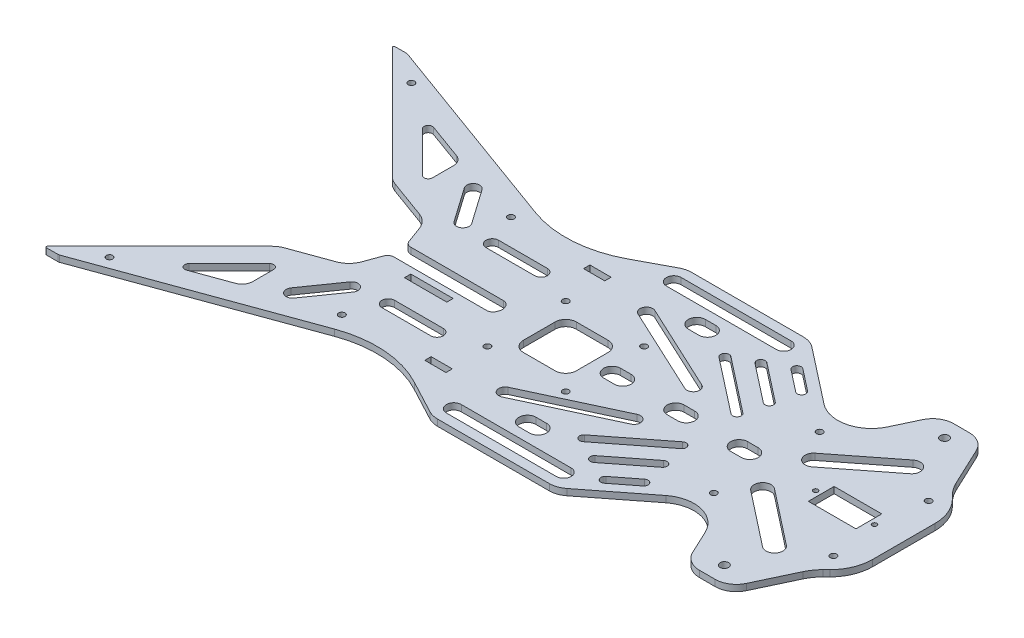
from build123d import *
from OCP.BRepFilletAPI import BRepFilletAPI_MakeFillet

# Parameters (mm, degrees)
BOSS_EXTRUDE1_DEPTH        = 3
CUT_EXTRUDE1_DEPTH         = 227.615470034
CUT_EXTRUDE2_DEPTH         = 227.615470034
CUT_EXTRUDE3_DEPTH         = 227.615470034
CUT_EXTRUDE4_DEPTH         = 227.615470034
CUT_EXTRUDE5_DEPTH         = 227.615470034
CUT_EXTRUDE6_DEPTH         = 227.615470034
CUT_EXTRUDE7_DEPTH         = 227.615470034
CUT_EXTRUDE8_DEPTH         = 227.615470034
CUT_EXTRUDE9_DEPTH         = 227.615470034
CUT_EXTRUDE10_DEPTH        = 227.615470034
CUT_EXTRUDE11_DEPTH        = 227.615470034
CUT_EXTRUDE13_DEPTH        = 227.615470034
CUT_EXTRUDE14_DEPTH        = 227.615470034
CUT_EXTRUDE15_DEPTH        = 227.615470034
CUT_EXTRUDE16_DEPTH        = 227.615470034
SKETCH18_W                 = 22.5
SKETCH18_H                 = 12.2
CUT_EXTRUDE17_DEPTH        = 227.615470034
CUT_EXTRUDE18_DEPTH        = 227.615470034
CUT_EXTRUDE19_DEPTH        = 227.615470034
CUT_EXTRUDE20_DEPTH        = 227.615470034
CUT_EXTRUDE21_DEPTH        = 227.615470034
CUT_EXTRUDE22_DEPTH        = 227.615470034
CUT_EXTRUDE23_DEPTH        = 227.615470034
DRAFT1_ANGLE               = 45
F_2_2_2_2_DIAMETER_HOLE1_D = 2.2
F_4_0_4_DIAMETER_HOLE1_D   = 4
F_3_0_3_DIAMETER_HOLE1_D   = 3
FILLET2_R                  = 10
FILLET3_R                  = 16
FILLET4_R                  = 20
FILLET5_R                  = 50
CUT_EXTRUDE25_DEPTH        = 227.615470034
CUT_EXTRUDE25_DEPTH_BACK   = 227.615470034
FILLET8_R                  = 10
FILLET9_R                  = 3
FILLET10_R                 = 10
FILLET12_R1                = 2
FILLET12_R2                = 0.5
CUT_EXTRUDE27_START        = -3
CUT_EXTRUDE27_OUTLINE_W    = 10
CUT_EXTRUDE27_OUTLINE_H    = 3
CUT_EXTRUDE27_OUTLINE_W_2  = 20
CUT_EXTRUDE27_DEPTH        = 3
CUT_EXTRUDE28_DEPTH        = 226.956841421
CUT_EXTRUDE28_DEPTH_BACK   = 226.956841421
SKETCH40_R                 = 1.5
CUT_EXTRUDE29_DEPTH        = 226.956841421
CUT_EXTRUDE29_DEPTH_BACK   = 226.956841421


# Read off the part's stored shape, not the designer's step: Cut-Extrude27
with BuildPart() as part:
    # Sketch1 → Boss-Extrude1 (new body)
    with BuildSketch(Plane.XZ):
        Polygon((-50, -60), (112.705882353, -60), (112.705882353, 60), (-50, 60), (-87.746184306, 39.929997795), (-204.125873456, 82.288740519), (-211.125873456, 82.288740519), (-155.729656663, 26.892523726), (-131.297648523, 18), (-124.746184306, 0), (-131.297648523, -18), (-155.729656663, -26.892523726), (-211.125873456, -82.288740519), (-204.125873456, -82.288740519), (-87.746184306, -39.929997795), align=None)
    extrude(amount=-BOSS_EXTRUDE1_DEPTH)

    # Sketch2 → Cut-Extrude1 (cut, through all)
    with BuildSketch(Plane(origin=(0, 3, 0), x_dir=(-1, 0, 0), z_dir=(0, 1, 0))):
        Polygon((-70, -60), (-8.731454638, -60), (-53.529411765, -25), align=None)
    extrude(amount=-CUT_EXTRUDE1_DEPTH, mode=Mode.SUBTRACT)

    # Sketch3 → Cut-Extrude2 (cut, through all)
    with BuildSketch(Plane(origin=(0, 3, 0), x_dir=(-1, 0, 0), z_dir=(0, 1, 0))):
        Polygon((-112.705882353, -60), (-90, -60), (-107.411764706, -23), (-112.705882353, -23), align=None)
    extrude(amount=-CUT_EXTRUDE2_DEPTH, mode=Mode.SUBTRACT)

    # Sketch4 → Cut-Extrude3 (cut, through all)
    with BuildSketch(Plane(origin=(0, 3, 0), x_dir=(-1, 0, 0), z_dir=(0, 1, 0))):
        Polygon((-112.705882353, 23), (-107.411764706, 23), (-90, 60), (-112.705882353, 60), align=None)
    extrude(amount=-CUT_EXTRUDE3_DEPTH, mode=Mode.SUBTRACT)

    # Sketch5 → Cut-Extrude4 (cut, through all)
    with BuildSketch(Plane(origin=(0, 3, 0), x_dir=(-1, 0, 0), z_dir=(0, 1, 0))):
        Polygon((-8.731454638, 60), (-70, 60), (-53.529411765, 25), align=None)
    extrude(amount=-CUT_EXTRUDE4_DEPTH, mode=Mode.SUBTRACT)

    # Sketch6 → Cut-Extrude5 (cut, through all)
    with BuildSketch(Plane.XZ):
        with BuildLine():
            Line((4.076457619, -48.448322168), (-47.828376286, -48.448322168))
            ThreePointArc((-47.828376286, -48.448322168), (-51.328376286, -51.948322168), (-47.828376286, -55.448322168))
            Line((-47.828376286, -55.448322168), (4.076457619, -55.448322168))
            ThreePointArc((4.076457619, -55.448322168), (7.576457619, -51.948322168), (4.076457619, -48.448322168))
        make_face()
    extrude(amount=-CUT_EXTRUDE5_DEPTH, mode=Mode.SUBTRACT)

    # Sketch7 → Cut-Extrude6 (cut, through all)
    with BuildSketch(Plane.XZ):
        with BuildLine():
            Line((-47.828376286, 48.448322168), (4.076457619, 48.448322168))
            ThreePointArc((4.076457619, 48.448322168), (7.576457619, 51.948322168), (4.076457619, 55.448322168))
            Line((4.076457619, 55.448322168), (-47.828376286, 55.448322168))
            ThreePointArc((-47.828376286, 55.448322168), (-51.328376286, 51.948322168), (-47.828376286, 48.448322168))
        make_face()
    extrude(amount=-CUT_EXTRUDE6_DEPTH, mode=Mode.SUBTRACT)

    # Sketch8 → Cut-Extrude7 (cut, through all)
    with BuildSketch(Plane.XZ):
        with BuildLine():
            Line((22.85209822, -23.564409536), (4.727850887, -37.724623468))
            ThreePointArc((4.727850887, -37.724623468), (4.383152331, -40.531967926), (7.190496789, -40.876666483))
            Line((7.190496789, -40.876666483), (25.314744122, -26.71645255))
            ThreePointArc((25.314744122, -26.71645255), (25.659442678, -23.909108092), (22.85209822, -23.564409536))
        make_face()
    extrude(amount=-CUT_EXTRUDE7_DEPTH, mode=Mode.SUBTRACT)

    # Sketch9 → Cut-Extrude8 (cut, through all)
    with BuildSketch(Plane.XZ):
        with BuildLine():
            Line((19.712045022, -11.423978493), (-6.292309847, -31.740807179))
            ThreePointArc((-6.292309847, -31.740807179), (-6.637008404, -34.548151636), (-3.829663946, -34.892850193))
            Line((-3.829663946, -34.892850193), (22.174690923, -14.576021507))
            ThreePointArc((22.174690923, -14.576021507), (22.51938948, -11.768677049), (19.712045022, -11.423978493))
        make_face()
    extrude(amount=-CUT_EXTRUDE8_DEPTH, mode=Mode.SUBTRACT)

    # Sketch10 → Cut-Extrude9 (cut, through all)
    with BuildSketch(Plane.XZ):
        with BuildLine():
            Line((4.727850887, 37.724623468), (22.85209822, 23.564409536))
            ThreePointArc((22.85209822, 23.564409536), (25.659442678, 23.909108092), (25.314744122, 26.71645255))
            Line((25.314744122, 26.71645255), (7.190496789, 40.876666483))
            ThreePointArc((7.190496789, 40.876666483), (4.383152331, 40.531967926), (4.727850887, 37.724623468))
        make_face()
    extrude(amount=-CUT_EXTRUDE9_DEPTH, mode=Mode.SUBTRACT)

    # Sketch11 → Cut-Extrude10 (cut, through all)
    with BuildSketch(Plane.XZ):
        with BuildLine():
            Line((15.748011622, 43.708439758), (25.992151418, 35.704840579))
            ThreePointArc((25.992151418, 35.704840579), (28.799495876, 36.049539136), (28.45479732, 38.856883593))
            Line((28.45479732, 38.856883593), (18.210657523, 46.860482773))
            ThreePointArc((18.210657523, 46.860482773), (15.403313065, 46.515784216), (15.748011622, 43.708439758))
        make_face()
    extrude(amount=-CUT_EXTRUDE10_DEPTH, mode=Mode.SUBTRACT)

    # Sketch12 → Cut-Extrude11 (cut, through all)
    with BuildSketch(Plane.XZ):
        with BuildLine():
            Line((-6.292309847, 31.740807179), (19.712045022, 11.423978493))
            ThreePointArc((19.712045022, 11.423978493), (22.51938948, 11.768677049), (22.174690923, 14.576021507))
            Line((22.174690923, 14.576021507), (-3.829663946, 34.892850193))
            ThreePointArc((-3.829663946, 34.892850193), (-6.637008404, 34.548151636), (-6.292309847, 31.740807179))
        make_face()
    extrude(amount=-CUT_EXTRUDE11_DEPTH, mode=Mode.SUBTRACT)

    # Sketch14 → Cut-Extrude13 (cut, through all)
    with BuildSketch(Plane.XZ):
        with BuildLine():
            Line((-20, -36), (-25, -36))
            ThreePointArc((-25, -36), (-29, -40), (-25, -44))
            Line((-25, -44), (-20, -44))
            ThreePointArc((-20, -44), (-16, -40), (-20, -36))
        make_face()
    extrude(amount=-CUT_EXTRUDE13_DEPTH, mode=Mode.SUBTRACT)

    # Sketch15 → Cut-Extrude14 (cut, through all)
    with BuildSketch(Plane.XZ):
        with BuildLine():
            Line((-20, 44), (-25, 44))
            ThreePointArc((-25, 44), (-29, 40), (-25, 36))
            Line((-25, 36), (-20, 36))
            ThreePointArc((-20, 36), (-16, 40), (-20, 44))
        make_face()
    extrude(amount=-CUT_EXTRUDE14_DEPTH, mode=Mode.SUBTRACT)

    # Sketch16 → Cut-Extrude15 (cut, through all)
    with BuildSketch(Plane.XZ):
        with BuildLine():
            Line((10, 4), (5, 4))
            ThreePointArc((5, 4), (1, 0), (5, -4))
            Line((5, -4), (10, -4))
            ThreePointArc((10, -4), (14, 0), (10, 4))
        make_face()
    extrude(amount=-CUT_EXTRUDE15_DEPTH, mode=Mode.SUBTRACT)

    # Sketch17 → Cut-Extrude16 (cut, through all)
    with BuildSketch(Plane.XZ):
        with BuildLine():
            Line((-20, 4), (-25, 4))
            ThreePointArc((-25, 4), (-29, 0), (-25, -4))
            Line((-25, -4), (-20, -4))
            ThreePointArc((-20, -4), (-16, 0), (-20, 4))
        make_face()
    extrude(amount=-CUT_EXTRUDE16_DEPTH, mode=Mode.SUBTRACT)

    # Sketch18 → Cut-Extrude17 (cut, through all)
    with BuildSketch(Plane.XZ):
        with Locations((85, 0)):
            Rectangle(SKETCH18_W, SKETCH18_H)
    extrude(amount=-CUT_EXTRUDE17_DEPTH, mode=Mode.SUBTRACT)

    # Sketch19 → Cut-Extrude18 (cut, through all)
    with BuildSketch(Plane.XZ):
        with BuildLine():
            Line((35, -4), (40, -4))
            ThreePointArc((40, -4), (44, 0), (40, 4))
            Line((40, 4), (35, 4))
            ThreePointArc((35, 4), (31, 0), (35, -4))
        make_face()
    extrude(amount=-CUT_EXTRUDE18_DEPTH, mode=Mode.SUBTRACT)

    # Sketch20 → Cut-Extrude19 (cut, through all)
    with BuildSketch(Plane.XZ):
        with BuildLine():
            Line((25.992151418, -35.704840579), (15.748011622, -43.708439758))
            ThreePointArc((15.748011622, -43.708439758), (15.403313065, -46.515784216), (18.210657523, -46.860482773))
            Line((18.210657523, -46.860482773), (28.45479732, -38.856883593))
            ThreePointArc((28.45479732, -38.856883593), (28.799495876, -36.049539136), (25.992151418, -35.704840579))
        make_face()
    extrude(amount=-CUT_EXTRUDE19_DEPTH, mode=Mode.SUBTRACT)

    # Sketch21 → Cut-Extrude20 (cut, through all)
    with BuildSketch(Plane.XZ):
        with BuildLine():
            Line((60.574154573, 8.905991549), (86.548049401, 29.261747183))
            ThreePointArc((86.548049401, 29.261747183), (87.22903597, 34.87746239), (81.613320763, 35.55844896))
            Line((81.613320763, 35.55844896), (55.639425934, 15.202693326))
            ThreePointArc((55.639425934, 15.202693326), (54.958439365, 9.586978118), (60.574154573, 8.905991549))
        make_face()
    extrude(amount=-CUT_EXTRUDE20_DEPTH, mode=Mode.SUBTRACT)

    # Sketch22 → Cut-Extrude21 (cut, through all)
    with BuildSketch(Plane.XZ):
        with BuildLine():
            Line((86.548049401, -29.261747183), (60.574154573, -8.905991549))
            ThreePointArc((60.574154573, -8.905991549), (54.958439365, -9.586978118), (55.639425934, -15.202693326))
            Line((55.639425934, -15.202693326), (81.613320763, -35.55844896))
            ThreePointArc((81.613320763, -35.55844896), (87.22903597, -34.87746239), (86.548049401, -29.261747183))
        make_face()
    extrude(amount=-CUT_EXTRUDE21_DEPTH, mode=Mode.SUBTRACT)

    # Sketch23 → Cut-Extrude22 (cut, through all)
    with BuildSketch(Plane.XZ):
        with BuildLine():
            Line((-1.606994387, -10.946270121), (-43.110707827, -30.29976954))
            ThreePointArc((-43.110707827, -30.29976954), (-44.561776403, -34.286547686), (-40.574998256, -35.737616262))
            Line((-40.574998256, -35.737616262), (0.928715183, -16.384116843))
            ThreePointArc((0.928715183, -16.384116843), (2.379783759, -12.397338697), (-1.606994387, -10.946270121))
        make_face()
    extrude(amount=-CUT_EXTRUDE22_DEPTH, mode=Mode.SUBTRACT)

    # Sketch24 → Cut-Extrude23 (cut, through all)
    with BuildSketch(Plane(origin=(0, 3, 0), x_dir=(-1, 0, 0), z_dir=(0, 1, 0))):
        with BuildLine():
            Line((2.283183606, 10.951076639), (43.786897045, 30.304576058))
            ThreePointArc((43.786897045, 30.304576058), (45.237965621, 34.291354204), (41.251187475, 35.74242278))
            Line((41.251187475, 35.74242278), (-0.252525965, 16.388923361))
            ThreePointArc((-0.252525965, 16.388923361), (-1.70359454, 12.402145215), (2.283183606, 10.951076639))
        make_face()
    extrude(amount=-CUT_EXTRUDE23_DEPTH, mode=Mode.SUBTRACT)

    # Draft1
    draft1_faces = [part.faces().sort_by_distance(p)[0] for p in [
        (110.058823529, 1.5, -23),
        (110.058823529, 1.5, 23),
    ]]
    draft(draft1_faces, Plane(origin=(112.705882353, 3, -60), x_dir=(0, 0, 1), z_dir=(1, 0, 0)), DRAFT1_ANGLE)

    # Ø2.2 (2.2) Diameter Hole1 (through all)
    with Locations(Plane(origin=(0, 0, 0), x_dir=(-1, 0, 0), z_dir=(0, -1, 0))):
        with Locations((-71.1, 0), (-98.9, 0)):
            Hole(F_2_2_2_2_DIAMETER_HOLE1_D / 2)

    # Ø4.0 (4) Diameter Hole1 (through all)
    with Locations(Plane(origin=(0, 0, 0), x_dir=(-1, 0, 0), z_dir=(0, -1, 0))):
        with Locations((-80, -52), (-80, 52)):
            Hole(F_4_0_4_DIAMETER_HOLE1_D / 2)

    # Ø3.0 (3) Diameter Hole1 (through all)
    with Locations(Plane(origin=(0, 3, 0), x_dir=(1, 0, 0), z_dir=(0, 1, 0))):
        with Locations((48, 25), (102, -22.5), (102, 22.5), (-191.125873456, 71.288740519), (-191.125873456, -71.288740519), (48, -25), (-112.746184306, 39.929997795), (-112.746184306, -39.929997795)):
            Hole(F_3_0_3_DIAMETER_HOLE1_D / 2)

    # Fillet2
    fillet2_edges = [part.edges().sort_by_distance(p)[0] for p in [
        (-50, 1.5, 60),
        (-50, 1.5, -60),
        (70, 1.5, -60),
        (8.731454638, 1.5, -60),
        (90, 1.5, -60),
        (90, 1.5, 60),
        (8.731454638, 1.5, 60),
        (70, 1.5, 60),
    ]]
    fillet(fillet2_edges, radius=FILLET2_R)

    # Fillet3
    fillet3_edges = [part.edges().sort_by_distance(p)[0] for p in [
        (53.529411765, 1.5, -25),
        (53.529411765, 1.5, 25),
    ]]
    fillet(fillet3_edges, radius=FILLET3_R)

    # Fillet4
    fillet4_edges = [part.edges().sort_by_distance(p)[0] for p in [
        (112.705882353, 1.5, -23),
        (102.705882353, 1.5, -33),
        (112.705882353, 1.5, 23),
        (102.705882353, 1.5, 33),
    ]]
    fillet(fillet4_edges, radius=FILLET4_R)

    # Fillet5
    fillet5_edges = [part.edges().sort_by_distance(p)[0] for p in [
        (-87.746184306, 1.5, 39.929997795),
        (-87.746184306, 1.5, -39.929997795),
    ]]
    fillet(fillet5_edges, radius=FILLET5_R)

    # Sketch34 → Cut-Extrude25 (cut, two sides: drawn at the far end of the back side and taken through both)
    with BuildSketch(Plane(origin=(0, 3, 0), x_dir=(1, 0, 0), z_dir=(0, 1, 0)).offset(-CUT_EXTRUDE25_DEPTH_BACK)):
        Polygon((-126.202065243, -4), (-78.202065243, -4), (-76.746184306, 0), (-78.202065243, 4), (-126.202065243, 4), (-124.746184306, 0), align=None)
    extrude(amount=CUT_EXTRUDE25_DEPTH + CUT_EXTRUDE25_DEPTH_BACK, mode=Mode.SUBTRACT)

    # Fillet8
    fillet8_edges = [part.edges().sort_by_distance(p)[0] for p in [
        (-131.297648523, 1.5, -18),
        (-131.297648523, 1.5, 18),
    ]]
    fillet(fillet8_edges, radius=FILLET8_R)

    # Fillet9
    fillet9_edges = [part.edges().sort_by_distance(p)[0] for p in [
        (-78.202065243, 1.5, -4),
        (-76.746184306, 1.5, 0),
        (-126.202065243, 1.5, 4),
        (-126.202065243, 1.5, -4),
        (-78.202065243, 1.5, 4),
    ]]
    fillet(fillet9_edges, radius=FILLET9_R)

    # Fillet10
    fillet10_edges = [part.edges().sort_by_distance(p)[0] for p in [
        (-155.729656663, 1.5, -26.892523726),
        (-155.729656663, 1.5, 26.892523726),
    ]]
    fillet(fillet10_edges, radius=FILLET10_R)

    # Fillet12: one fillet with a radius per group of edges: ONE call of the kernel's fillet builder (fillet() takes one radius for all edges)
    fillet12_edges_1 = [part.edges().sort_by_distance(p)[0] for p in [
        (-204.125873456, 1.5, -82.288740519),
        (-204.125873456, 1.5, 82.288740519),
    ]]
    fillet12_edges_2 = [part.edges().sort_by_distance(p)[0] for p in [
        (-211.125873456, 1.5, -82.288740519),
        (-211.125873456, 1.5, 82.288740519),
    ]]
    fillet12 = BRepFilletAPI_MakeFillet(part.part.solid().wrapped)
    for e in fillet12_edges_1:
        fillet12.Add(FILLET12_R1, e.wrapped)
    for e in fillet12_edges_2:
        fillet12.Add(FILLET12_R2, e.wrapped)
    add(Compound.cast(fillet12.Shape()), mode=Mode.REPLACE)

    # Cut-Extrude27 outline → Cut-Extrude27 (cut)
    with BuildSketch(Plane(origin=(0, 3, 0), x_dir=(1, 0, 0), z_dir=(0, 1, 0)).offset(CUT_EXTRUDE27_START)):
        with Locations((-69.509270733, 37.5)):
            Rectangle(CUT_EXTRUDE27_OUTLINE_W, CUT_EXTRUDE27_OUTLINE_H)
        with Locations((-69.509270733, -37.5)):
            Rectangle(CUT_EXTRUDE27_OUTLINE_W, CUT_EXTRUDE27_OUTLINE_H)
        with Locations((-103.101442628, -8.5)):
            Rectangle(CUT_EXTRUDE27_OUTLINE_W_2, CUT_EXTRUDE27_OUTLINE_H)
    extrude(amount=CUT_EXTRUDE27_DEPTH, mode=Mode.SUBTRACT)

    # Sketch40 → Cut-Extrude28 (cut, two sides: drawn at the far end of the back side and taken through both)
    with BuildSketch(Plane(origin=(0, 3, 0), x_dir=(1, 0, 0), z_dir=(0, 1, 0)).offset(-CUT_EXTRUDE28_DEPTH_BACK)):
        with Locations(Location((-28.43, 18.5, 0), (0, 0, 270))):
            Circle(SKETCH40_R)
        with Locations(Location((-65.43, 18.5, 0), (0, 0, 270))):
            Circle(SKETCH40_R)
        with Locations(Location((-65.43, -18.5, 0), (0, 0, 90))):
            Circle(SKETCH40_R)
        with Locations(Location((-28.43, -18.5, 0), (0, 0, 90))):
            Circle(SKETCH40_R)
    extrude(amount=CUT_EXTRUDE28_DEPTH + CUT_EXTRUDE28_DEPTH_BACK, mode=Mode.SUBTRACT)

    # Sketch41 → Cut-Extrude29 (cut, two sides: drawn at the far end of the back side and taken through both)
    with BuildSketch(Plane(origin=(0, 3, 0), x_dir=(1, 0, 0), z_dir=(0, 1, 0)).offset(-CUT_EXTRUDE29_DEPTH_BACK)):
        with BuildLine():
            Line((-150.636388959, 52.178382591), (-167.687695166, 58.384550506))
            ThreePointArc((-167.687695166, 58.384550506), (-170.058518344, 57.579764481), (-169.785949015, 55.090951702))
            Line((-169.785949015, 55.090951702), (-150.760703238, 36.065705925))
            ThreePointArc((-150.760703238, 36.065705925), (-148.581122811, 35.632160422), (-147.346489675, 37.479919487))
            Line((-147.346489675, 37.479919487), (-147.346489675, 47.479919487))
            ThreePointArc((-147.346489675, 47.479919487), (-148.250729454, 50.347801669), (-150.636388959, 52.178382591))
        make_face()
        with BuildLine():
            Line((-54.43, 12.5), (-39.43, 12.5))
            ThreePointArc((-39.43, 12.5), (-35.894466094, 11.035533906), (-34.43, 7.5))
            Line((-34.43, 7.5), (-34.43, -7.5))
            ThreePointArc((-34.43, -7.5), (-35.894466094, -11.035533906), (-39.43, -12.5))
            Line((-39.43, -12.5), (-54.43, -12.5))
            ThreePointArc((-54.43, -12.5), (-57.965533906, -11.035533906), (-59.43, -7.5))
            Line((-59.43, -7.5), (-59.43, 7.5))
            ThreePointArc((-59.43, 7.5), (-57.965533906, 11.035533906), (-54.43, 12.5))
        make_face()
        with BuildLine():
            Line((-169.785949015, -55.090951702), (-150.760703238, -36.065705925))
            ThreePointArc((-150.760703238, -36.065705925), (-148.581122811, -35.632160422), (-147.346489675, -37.479919487))
            Line((-147.346489675, -37.479919487), (-147.346489675, -47.479919487))
            ThreePointArc((-147.346489675, -47.479919487), (-148.250729454, -50.347801669), (-150.636388959, -52.178382591))
            Line((-150.636388959, -52.178382591), (-167.687695166, -58.384550506))
            ThreePointArc((-167.687695166, -58.384550506), (-170.058518344, -57.579764481), (-169.785949015, -55.090951702))
        make_face()
        with BuildLine():
            Line((-119.356788195, -28.008429962), (-130.828316922, -44.391470847))
            ThreePointArc((-130.828316922, -44.391470847), (-135.006502363, -45.128197671), (-135.743229187, -40.950012229))
            Line((-135.743229187, -40.950012229), (-124.27170046, -24.566971344))
            ThreePointArc((-124.27170046, -24.566971344), (-120.093515018, -23.83024452), (-119.356788195, -28.008429962))
        make_face()
        with BuildLine():
            Line((-106.193984181, -21.566971344), (-83.164082035, -21.566971344))
            ThreePointArc((-83.164082035, -21.566971344), (-80.164082035, -24.566971344), (-83.164082035, -27.566971344))
            Line((-83.164082035, -27.566971344), (-106.193984181, -27.566971344))
            ThreePointArc((-106.193984181, -27.566971344), (-109.193984181, -24.566971344), (-106.193984181, -21.566971344))
        make_face()
        with BuildLine():
            Line((-106.193984181, 21.566971344), (-83.164082035, 21.566971344))
            ThreePointArc((-83.164082035, 21.566971344), (-80.164082035, 24.566971344), (-83.164082035, 27.566971344))
            Line((-83.164082035, 27.566971344), (-106.193984181, 27.566971344))
            ThreePointArc((-106.193984181, 27.566971344), (-109.193984181, 24.566971344), (-106.193984181, 21.566971344))
        make_face()
        with BuildLine():
            Line((-119.356788195, 28.008429962), (-130.828316922, 44.391470847))
            ThreePointArc((-130.828316922, 44.391470847), (-135.006502363, 45.128197671), (-135.743229187, 40.950012229))
            Line((-135.743229187, 40.950012229), (-124.27170046, 24.566971344))
            ThreePointArc((-124.27170046, 24.566971344), (-120.093515018, 23.83024452), (-119.356788195, 28.008429962))
        make_face()
    extrude(amount=CUT_EXTRUDE29_DEPTH + CUT_EXTRUDE29_DEPTH_BACK, mode=Mode.SUBTRACT)


solid = part.part
